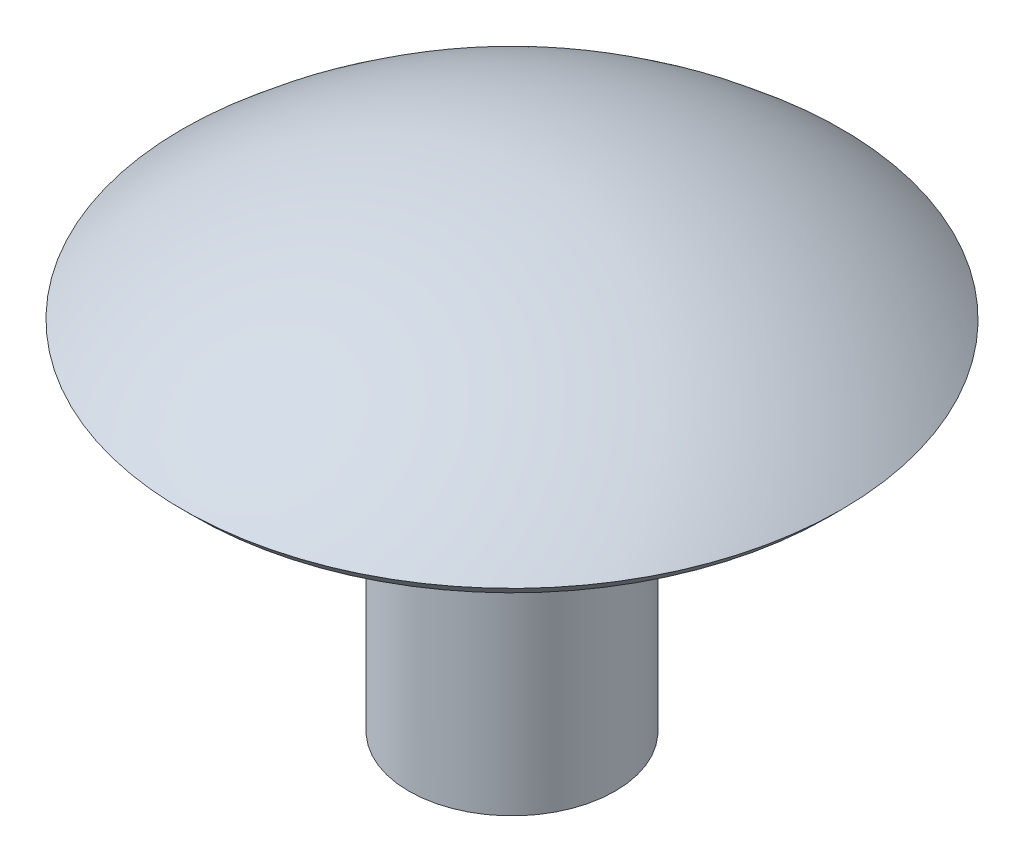
from build123d import *

# Parameters (mm, degrees)
SKETCH1_R           = 1.5
BOSS_EXTRUDE1_DEPTH = 5
FILLET2_R           = 0.4
CHAMFER1_SIZE       = 0.4
CHAMFER1_SIZE2      = 0.282926829


with BuildPart() as part:
    # Sketch1 → Boss-Extrude1 (new body)
    with BuildSketch(Plane(origin=(0, 0, 0), x_dir=(1, 0, 0), z_dir=(0, 1, 0))):
        Circle(SKETCH1_R)
    extrude(amount=BOSS_EXTRUDE1_DEPTH)

    # Sketch3 → Revolve1 (revolve)
    with BuildSketch(Plane.XY):
        with BuildLine():
            Line((0, 5), (-5, 5))
            ThreePointArc((-5, 5), (-2.692582404, 6.481456009), (0, 7))
            Line((0, 7), (0, 5))
        make_face()
    revolve(axis=Axis((0, 7, 0), (0, -1, 0)))

    # Fillet2
    fillet2_edges = [part.edges().sort_by_distance(p)[0] for p in [
        (-1.5, 5, 0),
    ]]
    fillet(fillet2_edges, radius=FILLET2_R)

    # Chamfer1
    chamfer1_edges = [part.edges().sort_by_distance(p)[0] for p in [
        (5, 5, 0),
    ]]
    chamfer1_side = [part.faces().sort_by_distance(p)[0] for p in [
        (-2.041421356, 5, 0),
    ]]
    chamfer(chamfer1_edges, length=CHAMFER1_SIZE, length2=CHAMFER1_SIZE2, reference=chamfer1_side[0])


solid = part.part
